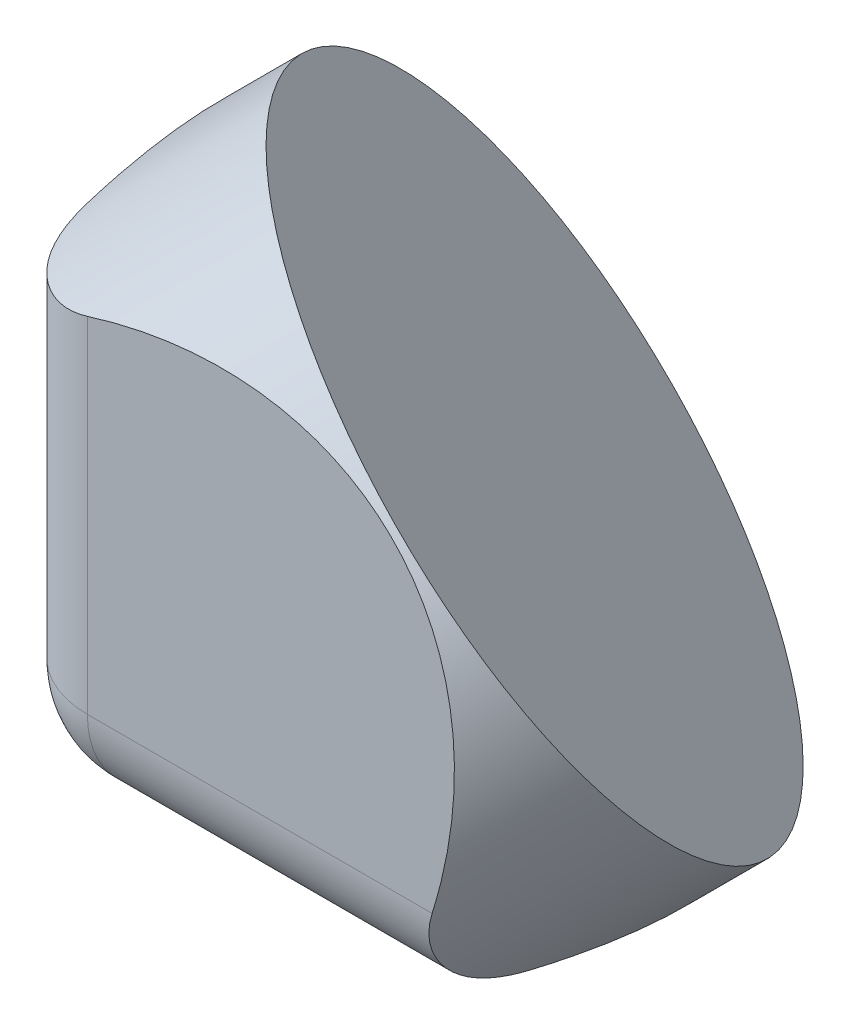
from build123d import *

# Parameters (mm, degrees)
SKETCH1_W          = 60.6
SKETCH1_H          = 60.6
EXTRUDE1_DEPTH     = 60.6
CUT_EXTRUDE2_DEPTH = 53.482278939
SKETCH3_R          = 36.55
CUT_EXTRUDE1_DEPTH = 53.482278939
FILLET1_R          = 10.9


with BuildPart() as part:
    # Sketch1 → Extrude1 (new body)
    with BuildSketch(Plane(origin=(0, 0, 0), x_dir=(1, 0, 0), z_dir=(0, 1, 0))):
        with Locations((30.3, 30.3)):
            Rectangle(SKETCH1_W, SKETCH1_H)
    extrude(amount=EXTRUDE1_DEPTH)

    # Sketch4 → Cut-Extrude2 (cut, through all)
    with BuildSketch(Plane(origin=(30.299342127, 30.299342127, -30.299342127), x_dir=(0.8164965809277261, -0.4082482904638631, 0.4082482904638628), z_dir=(-0.5773502691896256, -0.577350269189626, 0.5773502691896256))):
        Polygon((-49.479692804, 0), (-24.739846402, -42.85067094), (24.739846402, -42.85067094), (49.479692804, 0), (24.739846402, 42.85067094), (-24.739846402, 42.85067094), align=None)
    extrude(amount=-CUT_EXTRUDE2_DEPTH, mode=Mode.SUBTRACT)

    # Sketch3 → Cut-Extrude1 (cut, through all)
    with BuildSketch(Plane(origin=(30.299342127, 30.299342127, -30.299342127), x_dir=(0.8164965809277261, -0.4082482904638631, 0.4082482904638628), z_dir=(-0.5773502691896256, -0.577350269189626, 0.5773502691896256))):
        Polygon((-37.108963877, 21.426731029), (-24.739846402, 42.85067094), (-0.001611453, 42.85067094), (37.11057533, 21.423939911), (49.479692804, 0), (37.11057533, -21.423939911), (-0.001611453, -42.85067094), (-24.739846402, -42.85067094), (-37.108963877, -21.426731029), align=None)
        with Locations(Location((0, 0, 0), (0, 0, 120))):
            Circle(SKETCH3_R, mode=Mode.SUBTRACT)
    extrude(amount=CUT_EXTRUDE1_DEPTH, mode=Mode.SUBTRACT)

    # Fillet1
    # the kernel refuses this fillet: 10.9 mm, written as the material it takes off along each edge
    with BuildSketch(Plane(origin=(10.9, 10.9, -10.9), x_dir=(0, -1, 0), z_dir=(0, 0, 1))) as fillet1_piece_1_section:
        Polygon((0, 0), (FILLET1_R, 0), (FILLET1_R, -FILLET1_R), (0, -FILLET1_R), align=None)
    fillet1_piece_1 = extrude(amount=FILLET1_R, mode=Mode.PRIVATE)
    fillet1_piece_1 = fillet1_piece_1 - Plane(origin=(10.9, 10.9, -10.9), x_dir=(0.7071067811865475, 0.7071067811865475, 0), z_dir=(0, 0, 1)) * Sphere(FILLET1_R, mode=Mode.PRIVATE)
    add(fillet1_piece_1, mode=Mode.SUBTRACT)
    with BuildSketch(Plane(origin=(0, 0, -72.014425049), x_dir=(1, 0, 0), z_dir=(0, 0, 1)), Plane(origin=(0, 10.9, 0), x_dir=(1, 0, 0), z_dir=(0, 1, 0))) as fillet1_piece_2:
        with BuildLine():
            CenterArc((FILLET1_R, FILLET1_R), FILLET1_R, 180, 90)
            Line((0, FILLET1_R), (0, 0))
            Line((0, 0), (FILLET1_R, 0))
        make_face()
    extrude(amount=61.114425049, mode=Mode.SUBTRACT)
    with BuildSketch(Plane(origin=(10.9, 0, 0), x_dir=(0, 1, 0), z_dir=(1, 0, 0))) as fillet1_piece_3:
        with BuildLine():
            CenterArc((FILLET1_R, -FILLET1_R), FILLET1_R, 90, 90)
            Line((0, -FILLET1_R), (0, 0))
            Line((0, 0), (FILLET1_R, 0))
        make_face()
    extrude(amount=61.114425049, mode=Mode.SUBTRACT)


solid = part.part
